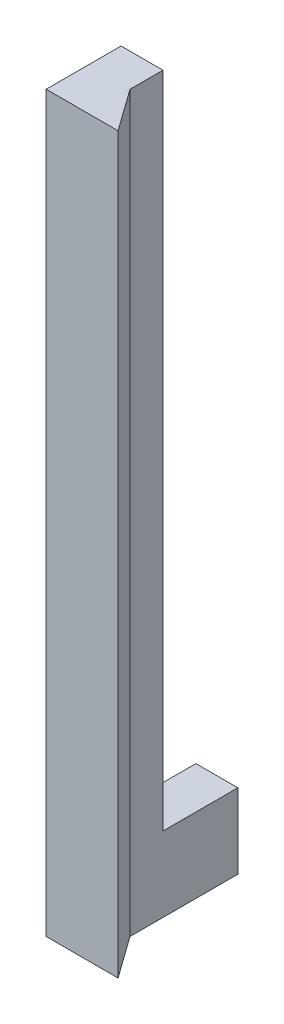
from build123d import *

# Parameters (mm, degrees)
BOSS_EXTRUDE1_DEPTH = 49
SKETCH2_W           = 2.8
SKETCH2_H           = 5
BOSS_EXTRUDE2_DEPTH = 5


with BuildPart() as part:
    # Sketch1 → Boss-Extrude1 (new body)
    with BuildSketch(Plane(origin=(0, 0, 0), x_dir=(1, 0, 0), z_dir=(0, 1, 0))):
        Polygon((-1.4, 2.5), (-1.4, -2.5), (3.4, -2.5), (1.4, 0.3), (1.4, 2.5), align=None)
    extrude(amount=BOSS_EXTRUDE1_DEPTH)

    # Sketch2 → Boss-Extrude2 (add)
    with BuildSketch(Plane(origin=(0, 0, -2.5), x_dir=(-1, 0, 0), z_dir=(0, 0, -1))):
        with Locations((0, 2.5)):
            Rectangle(SKETCH2_W, SKETCH2_H)
    extrude(amount=BOSS_EXTRUDE2_DEPTH)


solid = part.part
